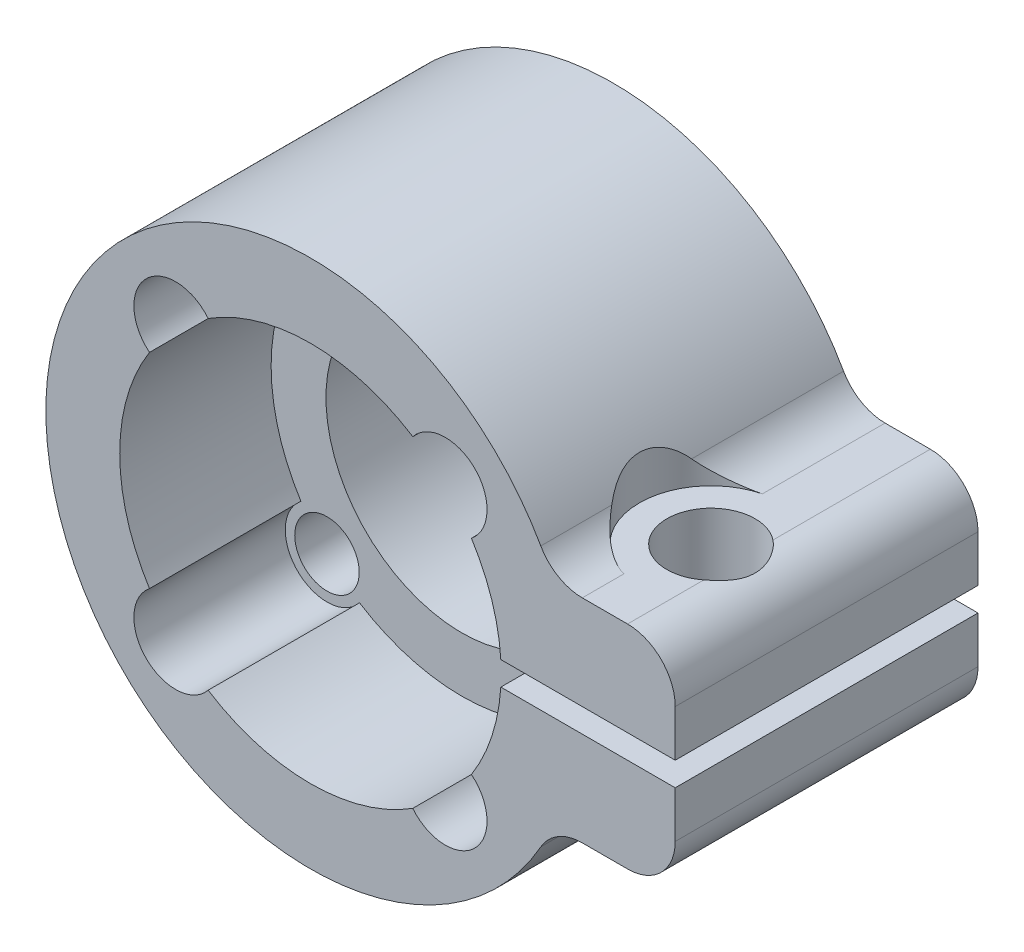
from build123d import *

# Parameters (mm, degrees)
BOSS_EXTRUDE1_DEPTH       = 6.35
F_6_32_TAPPED_HOLE3_D     = 2.7051
SKETCH14_R                = 1.85
CUT_EXTRUDE6_DEPTH        = 21.223068511
F_6_32_TAPPED_HOLE5_D     = 2.7051
F_6_32_TAPPED_HOLE5_DEPTH = 50.8
F_6_32_TAPPED_HOLE5_TIP   = 0.81269403
SKETCH24_R                = 3
CUT_EXTRUDE26_DEPTH       = 36.126165479
FILLET1_R                 = 2
SKETCH28_R                = 1.75
CUT_EXTRUDE27_DEPTH       = 6.35


with BuildPart() as part:
    # Sketch1 → Boss-Extrude1 (new, symmetric)
    with BuildSketch(Plane.XY):
        with BuildLine():
            Line((0, 0), (0, 0.5))
            Line((0, 0.5), (15.3, 0.5))
            Line((15.3, 0.5), (15.3, 4.45))
            Line((15.3, 4.45), (11.402083143, 4.45))
            ThreePointArc((11.402083143, 4.45), (10.394478471, 4.722362068), (9.661307091, 5.465267176))
            ThreePointArc((9.661307091, 5.465267176), (-11.1, 0), (9.661307091, -5.465267176))
            ThreePointArc((9.661307091, -5.465267176), (10.394478471, -4.722362068), (11.402083143, -4.45))
            Line((11.402083143, -4.45), (15.3, -4.45))
            Line((15.3, -4.45), (15.3, -0.5))
            Line((15.3, -0.5), (0, -0.5))
            Line((0, -0.5), (0, 0))
        make_face()
    extrude(amount=BOSS_EXTRUDE1_DEPTH, both=True)

    # Sketch27 → Cut-Revolve1 (revolve, cut)
    with BuildSketch(Plane(origin=(0, 0, 0), x_dir=(1, 0, 0), z_dir=(0, 1, 0))):
        Polygon((0, 6.35), (5.7, 6.35), (5.7, 0), (8, 0), (8, -6.35), (0, -6.35), align=None)
    revolve(axis=Axis((0, 0, -6.35), (0, 0, 1)), mode=Mode.SUBTRACT)

    # #6-32 Tapped Hole3 (through all)
    with Locations(Plane(origin=(-5.656516225, 5.657192254, -6.35), x_dir=(-1, 0, 0), z_dir=(0, 0, -1))):
        with Locations((0, 0), (-11.313708479, -0.000676029), (-11.31303245, -11.314384508), (0.000676029, -11.313708479)):
            Hole(F_6_32_TAPPED_HOLE3_D / 2)

    # Sketch14 → Cut-Extrude6 (cut, through all)
    with BuildSketch(Plane.XZ.offset(-0.5)):
        with Locations(Location((12.15, 1.7, 0), (0, 0, 270))):
            Circle(SKETCH14_R)
    extrude(amount=-CUT_EXTRUDE6_DEPTH, mode=Mode.SUBTRACT)

    # #6-32 Tapped Hole5
    with Locations(Plane(origin=(0, -0.5, 0), x_dir=(-1, 0, 0), z_dir=(0, 1, 0))):
        with Locations((-12.15, 1.7)):
            Hole(F_6_32_TAPPED_HOLE5_D / 2, depth=F_6_32_TAPPED_HOLE5_DEPTH)
            with Locations((0, 0, -(F_6_32_TAPPED_HOLE5_DEPTH + F_6_32_TAPPED_HOLE5_TIP / 2))):  # 118° drill point
                Cone(0, F_6_32_TAPPED_HOLE5_D / 2, F_6_32_TAPPED_HOLE5_TIP, mode=Mode.SUBTRACT)

    # Sketch24 → Cut-Extrude26 (cut, through all)
    with BuildSketch(Plane(origin=(19.75, 4.45, 0), x_dir=(0, 0, -1), z_dir=(0, 1, 0))):
        with Locations((-1.7, 7.6)):
            Circle(SKETCH24_R)
    extrude(amount=CUT_EXTRUDE26_DEPTH, mode=Mode.SUBTRACT)

    # Fillet1
    # the kernel refuses this fillet: 2 mm, written as the material it takes off along each edge
    with BuildSketch(Plane(origin=(15.3, -4.45, -11.35), x_dir=(0, 1, 0), z_dir=(0, 0, 1))) as fillet1_piece_1:
        with BuildLine():
            CenterArc((FILLET1_R, FILLET1_R), FILLET1_R, 180, 90)
            Line((0, FILLET1_R), (0, 0))
            Line((0, 0), (FILLET1_R, 0))
        make_face()
    extrude(amount=22.7, mode=Mode.SUBTRACT)
    with BuildSketch(Plane(origin=(15.3, 4.45, -11.35), x_dir=(0, -1, 0), z_dir=(0, 0, 1))) as fillet1_piece_2:
        with BuildLine():
            CenterArc((FILLET1_R, -FILLET1_R), FILLET1_R, 90, 90)
            Line((0, -FILLET1_R), (0, 0))
            Line((0, 0), (FILLET1_R, 0))
        make_face()
    extrude(amount=22.7, mode=Mode.SUBTRACT)

    # Sketch28 → Cut-Extrude27 (cut)
    with BuildSketch(Plane.XY.offset(6.35)):
        with Locations((5.656516225, -5.657192254)):
            Circle(SKETCH28_R)
        with Locations((-5.656516225, 5.657192254)):
            Circle(SKETCH28_R)
        with Locations((5.657192254, 5.656516225)):
            Circle(SKETCH28_R)
        with Locations((-5.657192254, -5.656516225)):
            Circle(SKETCH28_R)
    extrude(amount=-CUT_EXTRUDE27_DEPTH, mode=Mode.SUBTRACT)


solid = part.part
